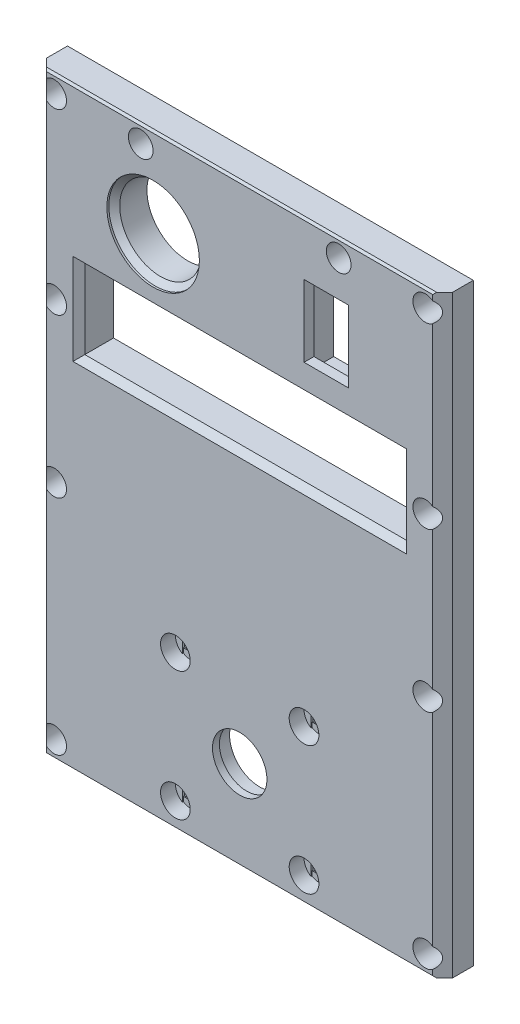
from build123d import *

# Parameters (mm, degrees)
SKETCH1_W                = 82
SKETCH1_H                = 120
SKETCH1_W_2              = 68
SKETCH1_H_2              = 106
BOSS_EXTRUDE1_DEPTH      = 7
SKETCH2_W                = 68
SKETCH2_H                = 36
BOSS_EXTRUDE2_DEPTH      = 7
SKETCH3_R                = 5.5
CUT_EXTRUDE1_DEPTH       = 74.006848994
SKETCH4_R                = 6.05
CUT_EXTRUDE2_DEPTH       = 5.6
SKETCH5_R                = 11
CUT_EXTRUDE3_DEPTH       = 3
SKETCH6_R                = 1.6
CUT_EXTRUDE4_DEPTH       = 74.006848994
SKETCH7_W                = 50
SKETCH7_H                = 38
CUT_EXTRUDE5_DEPTH       = 1
SKETCH8_R                = 3
CUT_EXTRUDE6_DEPTH       = 3
SKETCH9_R                = 1.35
CUT_EXTRUDE7_DEPTH       = 74.006848994
SKETCH10_R               = 2.5
CUT_EXTRUDE8_DEPTH       = 5
CHAMFER1_SIZE            = 2
SKETCH11_W               = 68
SKETCH11_H               = 19
BOSS_EXTRUDE3_DEPTH      = 7
SKETCH12_R               = 1.35
CUT_EXTRUDE9_DEPTH       = 74.006848994
SKETCH13_R               = 2.5
CUT_EXTRUDE10_DEPTH      = 5
CHAMFER2_SIZE            = 0.8
CUT_EXTRUDE11_DEPTH      = 0.2
SKETCH15_W               = 2.7
SKETCH15_H               = 2.7
CUT_EXTRUDE12_DEPTH      = 0.2
CUT_EXTRUDE13_DEPTH      = 0.2
SKETCH17_W               = 3.2
SKETCH17_H               = 3.2
CUT_EXTRUDE14_DEPTH      = 0.2
SKETCH18_W               = 69.6
SKETCH18_H               = 52.6
BOSS_EXTRUDE4_DEPTH      = 7
CUT_EXTRUDE15_DEPTH      = 74.006848994
CUT_EXTRUDE15_DEPTH_BACK = 74.006848994
SKETCH19_R               = 8.25
SKETCH19_W               = 9
SKETCH19_H               = 14.5
SKETCH20_W               = 11
SKETCH20_H               = 20.5
CUT_EXTRUDE16_DEPTH      = 5
SKETCH21_W               = 65
SKETCH21_H               = 16
CUT_EXTRUDE17_DEPTH      = 74.006848994
SKETCH22_R               = 9.35
CUT_EXTRUDE18_DEPTH      = 1.6
CHAMFER3_SIZE            = 1.2
CHAMFER4_SIZE            = 1.2
CHAMFER5_SIZE            = 0.4


with BuildPart() as part:
    # Sketch1 → Boss-Extrude1 (new body)
    with BuildSketch(Plane.XY):
        Rectangle(SKETCH1_W, SKETCH1_H)
        Rectangle(SKETCH1_W_2, SKETCH1_H_2, mode=Mode.SUBTRACT)
    extrude(amount=BOSS_EXTRUDE1_DEPTH)

    # Sketch2 → Boss-Extrude2 (add)
    with BuildSketch(Plane.XY.offset(7)):
        with Locations((0, -35)):
            Rectangle(SKETCH2_W, SKETCH2_H)
    extrude(amount=-BOSS_EXTRUDE2_DEPTH)

    # Sketch3 → Cut-Extrude1 (cut, through all)
    with BuildSketch(Plane(origin=(0, 0, 0), x_dir=(-1, 0, 0), z_dir=(0, 0, -1))):
        with Locations((0, -42)):
            Circle(SKETCH3_R)
    extrude(amount=-CUT_EXTRUDE1_DEPTH, mode=Mode.SUBTRACT)

    # Sketch4 → Cut-Extrude2 (cut)
    with BuildSketch(Plane(origin=(0, 0, 0), x_dir=(-1, 0, 0), z_dir=(0, 0, -1))):
        with Locations((0, -42)):
            Circle(SKETCH4_R)
    extrude(amount=-CUT_EXTRUDE2_DEPTH, mode=Mode.SUBTRACT)

    # Sketch5 → Cut-Extrude3 (cut)
    with BuildSketch(Plane(origin=(0, 0, 0), x_dir=(-1, 0, 0), z_dir=(0, 0, -1))):
        with Locations((0, -42)):
            Circle(SKETCH5_R)
    extrude(amount=-CUT_EXTRUDE3_DEPTH, mode=Mode.SUBTRACT)

    # Sketch6 → Cut-Extrude4 (cut, through all)
    with BuildSketch(Plane(origin=(0, 0, 0), x_dir=(-1, 0, 0), z_dir=(0, 0, -1))):
        with Locations((-13, -29)):
            Circle(SKETCH6_R)
        with Locations((13, -29)):
            Circle(SKETCH6_R)
        with Locations((13, -55)):
            Circle(SKETCH6_R)
        with Locations((-13, -55)):
            Circle(SKETCH6_R)
    extrude(amount=-CUT_EXTRUDE4_DEPTH, mode=Mode.SUBTRACT)

    # Sketch7 → Cut-Extrude5 (cut)
    with BuildSketch(Plane(origin=(0, 0, 0), x_dir=(-1, 0, 0), z_dir=(0, 0, -1))):
        with Locations((0, -42)):
            Rectangle(SKETCH7_W, SKETCH7_H)
    extrude(amount=-CUT_EXTRUDE5_DEPTH, mode=Mode.SUBTRACT)

    # Sketch8 → Cut-Extrude6 (cut)
    with BuildSketch(Plane.XY.offset(7)):
        with Locations((-13, -29)):
            Circle(SKETCH8_R)
        with Locations((13, -29)):
            Circle(SKETCH8_R)
        with Locations((13, -55)):
            Circle(SKETCH8_R)
        with Locations((-13, -55)):
            Circle(SKETCH8_R)
    extrude(amount=-CUT_EXTRUDE6_DEPTH, mode=Mode.SUBTRACT)

    # Sketch9 → Cut-Extrude7 (cut, through all)
    with BuildSketch(Plane.XY.offset(7)):
        with Locations((-37.5, 56.5)):
            Circle(SKETCH9_R)
        with Locations((37.5, 56.5)):
            Circle(SKETCH9_R)
        with Locations((-37.5, -56.5)):
            Circle(SKETCH9_R)
        with Locations((37.5, -56.5)):
            Circle(SKETCH9_R)
        with Locations((-37.5, 20.5)):
            Circle(SKETCH9_R)
        with Locations((37.5, 20.5)):
            Circle(SKETCH9_R)
        with Locations((37.5, -11.5)):
            Circle(SKETCH9_R)
        with Locations((-37.5, -11.5)):
            Circle(SKETCH9_R)
    extrude(amount=-CUT_EXTRUDE7_DEPTH, mode=Mode.SUBTRACT)

    # Sketch10 → Cut-Extrude8 (cut)
    with BuildSketch(Plane.XY.offset(7)):
        with Locations((-37.5, 56.5)):
            Circle(SKETCH10_R)
        with Locations((37.5, 20.5)):
            Circle(SKETCH10_R)
        with Locations((-37.5, 20.5)):
            Circle(SKETCH10_R)
        with Locations((37.5, 56.5)):
            Circle(SKETCH10_R)
        with Locations((-37.5, -56.5)):
            Circle(SKETCH10_R)
        with Locations((37.5, -56.5)):
            Circle(SKETCH10_R)
        with Locations((-37.5, -11.5)):
            Circle(SKETCH10_R)
        with Locations((37.5, -11.5)):
            Circle(SKETCH10_R)
    extrude(amount=-CUT_EXTRUDE8_DEPTH, mode=Mode.SUBTRACT)

    # Chamfer1
    # the kernel refuses this chamfer: 2 mm, written as the material it takes off along each edge
    with BuildSketch(Plane(origin=(-41, 65.143365976, 7), x_dir=(0.9996219169112968, 0, 0.02749587661058651), z_dir=(0, -1, 0))) as chamfer1_piece_1:
        Polygon((CHAMFER1_SIZE * 0.999621916911, -CHAMFER1_SIZE * 0.0274958766106), (-CHAMFER1_SIZE * 0.0274958766106, -CHAMFER1_SIZE * 0.999621916911), (0, 0), align=None)
    extrude(amount=130.286731952, mode=Mode.SUBTRACT)
    with BuildSketch(Plane(origin=(41, -65.143365976, 7), x_dir=(0.027495876610585623, 0, -0.9996219169112968), z_dir=(0, 1, 0))) as chamfer1_piece_2:
        Polygon((CHAMFER1_SIZE * 0.999621916911, CHAMFER1_SIZE * 0.0274958766106), (-CHAMFER1_SIZE * 0.0274958766106, CHAMFER1_SIZE * 0.999621916911), (0, 0), align=None)
    extrude(amount=130.286731952, mode=Mode.SUBTRACT)

    # Sketch11 → Boss-Extrude3 (add)
    with BuildSketch(Plane.XY.offset(7)):
        with Locations((0, -7.5)):
            Rectangle(SKETCH11_W, SKETCH11_H)
    extrude(amount=-BOSS_EXTRUDE3_DEPTH)

    # Sketch12 → Cut-Extrude9 (cut, through all)
    with BuildSketch(Plane.XY.offset(7)):
        with Locations((-20, 56.5)):
            Circle(SKETCH12_R)
        with Locations((20, 56.5)):
            Circle(SKETCH12_R)
    extrude(amount=-CUT_EXTRUDE9_DEPTH, mode=Mode.SUBTRACT)

    # Sketch13 → Cut-Extrude10 (cut)
    with BuildSketch(Plane.XY.offset(7)):
        with Locations((-20, 56.5)):
            Circle(SKETCH13_R)
        with Locations((20, 56.5)):
            Circle(SKETCH13_R)
    extrude(amount=-CUT_EXTRUDE10_DEPTH, mode=Mode.SUBTRACT)

    # Chamfer2
    chamfer2_edges = [part.edges().sort_by_distance(p)[0] for p in [
        (0, 53, 0),
        (-34, 27.5, 0),
        (0, 53, 7),
        (-34, 27.5, 7),
        (34, 27.5, 7),
        (34, 27.5, 0),
        (0, 2, 7),
        (0, 2, 0),
        (-33, -60, 0),
        (-41, 0, 0),
        (0, 60, 0),
        (41, 0, 0),
    ]]
    chamfer(chamfer2_edges, length=CHAMFER2_SIZE)

    # Sketch14 → Cut-Extrude11 (cut)
    with BuildSketch(Plane.XY.offset(2)):
        with BuildLine():
            Line((-38.85, -13.604162541), (-38.85, -9.395837459))
            ThreePointArc((-38.85, -9.395837459), (-37.5, -9), (-36.15, -9.395837459))
            Line((-36.15, -9.395837459), (-36.15, -13.604162541))
            ThreePointArc((-36.15, -13.604162541), (-37.5, -14), (-38.85, -13.604162541))
        make_face()
        with BuildLine():
            Line((-38.85, -58.604162541), (-38.85, -54.395837459))
            ThreePointArc((-38.85, -54.395837459), (-37.5, -54), (-36.15, -54.395837459))
            Line((-36.15, -54.395837459), (-36.15, -58.604162541))
            ThreePointArc((-36.15, -58.604162541), (-37.5, -59), (-38.85, -58.604162541))
        make_face()
        with BuildLine():
            Line((-38.85, 18.395837459), (-38.85, 22.604162541))
            ThreePointArc((-38.85, 22.604162541), (-37.5, 23), (-36.15, 22.604162541))
            Line((-36.15, 22.604162541), (-36.15, 18.395837459))
            ThreePointArc((-36.15, 18.395837459), (-37.5, 18), (-38.85, 18.395837459))
        make_face()
        with BuildLine():
            Line((-21.35, 54.395837459), (-21.35, 58.604162541))
            ThreePointArc((-21.35, 58.604162541), (-20, 59), (-18.65, 58.604162541))
            Line((-18.65, 58.604162541), (-18.65, 54.395837459))
            ThreePointArc((-18.65, 54.395837459), (-20, 54), (-21.35, 54.395837459))
        make_face()
        with BuildLine():
            Line((-38.85, 54.395837459), (-38.85, 58.604162541))
            ThreePointArc((-38.85, 58.604162541), (-37.5, 59), (-36.15, 58.604162541))
            Line((-36.15, 58.604162541), (-36.15, 54.395837459))
            ThreePointArc((-36.15, 54.395837459), (-37.5, 54), (-38.85, 54.395837459))
        make_face()
    cut_extrude11 = extrude(amount=-CUT_EXTRUDE11_DEPTH, mode=Mode.SUBTRACT)

    # Sketch15 → Cut-Extrude12 (cut)
    with BuildSketch(Plane.XY.offset(1.8)):
        with Locations((-37.5, -56.5)):
            Rectangle(SKETCH15_W, SKETCH15_H)
        with Locations((-37.5, -11.5)):
            Rectangle(SKETCH15_W, SKETCH15_H)
        with Locations((-37.5, 20.5)):
            Rectangle(SKETCH15_W, SKETCH15_H)
        with Locations((-37.5, 56.5)):
            Rectangle(SKETCH15_W, SKETCH15_H)
        with Locations((-20, 56.5)):
            Rectangle(SKETCH15_W, SKETCH15_H)
    cut_extrude12 = extrude(amount=-CUT_EXTRUDE12_DEPTH, mode=Mode.SUBTRACT)

    # Sketch16 → Cut-Extrude13 (cut)
    with BuildSketch(Plane.XY.offset(4)):
        with BuildLine():
            Line((-14.6, -31.537715508), (-14.6, -26.462284492))
            ThreePointArc((-14.6, -26.462284492), (-13, -26), (-11.4, -26.462284492))
            Line((-11.4, -26.462284492), (-11.4, -31.537715508))
            ThreePointArc((-11.4, -31.537715508), (-13, -32), (-14.6, -31.537715508))
        make_face()
        with BuildLine():
            Line((-14.6, -57.537715508), (-14.6, -52.462284492))
            ThreePointArc((-14.6, -52.462284492), (-13, -52), (-11.4, -52.462284492))
            Line((-11.4, -52.462284492), (-11.4, -57.537715508))
            ThreePointArc((-11.4, -57.537715508), (-13, -58), (-14.6, -57.537715508))
        make_face()
    cut_extrude13 = extrude(amount=-CUT_EXTRUDE13_DEPTH, mode=Mode.SUBTRACT)

    # Sketch17 → Cut-Extrude14 (cut)
    with BuildSketch(Plane.XY.offset(3.8)):
        with Locations((-13, -29)):
            Rectangle(SKETCH17_W, SKETCH17_H)
        with Locations((-13, -55)):
            Rectangle(SKETCH17_W, SKETCH17_H)
    cut_extrude14 = extrude(amount=-CUT_EXTRUDE14_DEPTH, mode=Mode.SUBTRACT)

    # Mirror1: Cut-Extrude11, Cut-Extrude12, Cut-Extrude13, Cut-Extrude14 across plane
    add(cut_extrude11.mirror(Plane(origin=(0, 0, 0), x_dir=(0, 0, 1), z_dir=(1, 0, 0))), mode=Mode.SUBTRACT)
    add(cut_extrude12.mirror(Plane(origin=(0, 0, 0), x_dir=(0, 0, 1), z_dir=(1, 0, 0))), mode=Mode.SUBTRACT)
    add(cut_extrude13.mirror(Plane(origin=(0, 0, 0), x_dir=(0, 0, 1), z_dir=(1, 0, 0))), mode=Mode.SUBTRACT)
    add(cut_extrude14.mirror(Plane(origin=(0, 0, 0), x_dir=(0, 0, 1), z_dir=(1, 0, 0))), mode=Mode.SUBTRACT)

    # Sketch18 → Boss-Extrude4 (add)
    with BuildSketch(Plane(origin=(0, 0, 0), x_dir=(-1, 0, 0), z_dir=(0, 0, -1))):
        with Locations((0, 27.5)):
            Rectangle(SKETCH18_W, SKETCH18_H)
    extrude(amount=-BOSS_EXTRUDE4_DEPTH)

    # Sketch19 → Cut-Extrude15 (cut, two sides: drawn at the far end of the back side and taken through both)
    with BuildSketch(Plane.XY.offset(7).offset(-CUT_EXTRUDE15_DEPTH_BACK)):
        with Locations((-17.5, 42)):
            Circle(SKETCH19_R)
        with Locations((17.5, 42)):
            Rectangle(SKETCH19_W, SKETCH19_H)
    extrude(amount=CUT_EXTRUDE15_DEPTH + CUT_EXTRUDE15_DEPTH_BACK, mode=Mode.SUBTRACT)

    # Sketch20 → Cut-Extrude16 (cut)
    with BuildSketch(Plane(origin=(0, 0, 0), x_dir=(-1, 0, 0), z_dir=(0, 0, -1))):
        with Locations((-17.5, 42)):
            Rectangle(SKETCH20_W, SKETCH20_H)
    extrude(amount=-CUT_EXTRUDE16_DEPTH, mode=Mode.SUBTRACT)

    # Sketch21 → Cut-Extrude17 (cut, through all)
    with BuildSketch(Plane(origin=(0, 0, 0), x_dir=(-1, 0, 0), z_dir=(0, 0, -1))):
        with Locations((0, 20.75)):
            Rectangle(SKETCH21_W, SKETCH21_H)
    extrude(amount=-CUT_EXTRUDE17_DEPTH, mode=Mode.SUBTRACT)

    # Sketch22 → Cut-Extrude18 (cut)
    with BuildSketch(Plane.XY.offset(7)):
        with Locations((-17.5, 42)):
            Circle(SKETCH22_R)
    extrude(amount=-CUT_EXTRUDE18_DEPTH, mode=Mode.SUBTRACT)

    # Chamfer3
    # the kernel refuses this chamfer: 1.2 mm, written as the material it adds along each edge
    with BuildSketch(Plane(origin=(-17.5, 42, 5.4), x_dir=(1, 0, 0), z_dir=(0, -1, 0))) as chamfer3_piece_1_section:
        Polygon((9.35, CHAMFER3_SIZE), (9.35 - CHAMFER3_SIZE, 0), (9.35, 0), align=None)
    chamfer3_piece_1 = revolve(axis=Axis((-17.5, 42, 5.4), (0, 0, 1)), mode=Mode.PRIVATE)
    chamfer3_piece_1 = chamfer3_piece_1 - Plane(origin=(-17.5, 42, 6.042009959), x_dir=(1, 0, 0), z_dir=(0, 0, 1)) * Cylinder(8.25, 38, mode=Mode.PRIVATE)
    add(chamfer3_piece_1)

    # Chamfer4
    chamfer4_edges = [part.edges().sort_by_distance(p)[0] for p in [
        (-32.5, 20.75, 7),
        (0, 12.75, 7),
        (32.5, 20.75, 7),
        (0, 28.75, 7),
    ]]
    chamfer(chamfer4_edges, length=CHAMFER4_SIZE)

    # Chamfer5
    chamfer5_edges = [part.edges().sort_by_distance(p)[0] for p in [
        (0, 60, 7),
        (0, -60, 7),
    ]]
    chamfer(chamfer5_edges, length=CHAMFER5_SIZE)


solid = part.part
